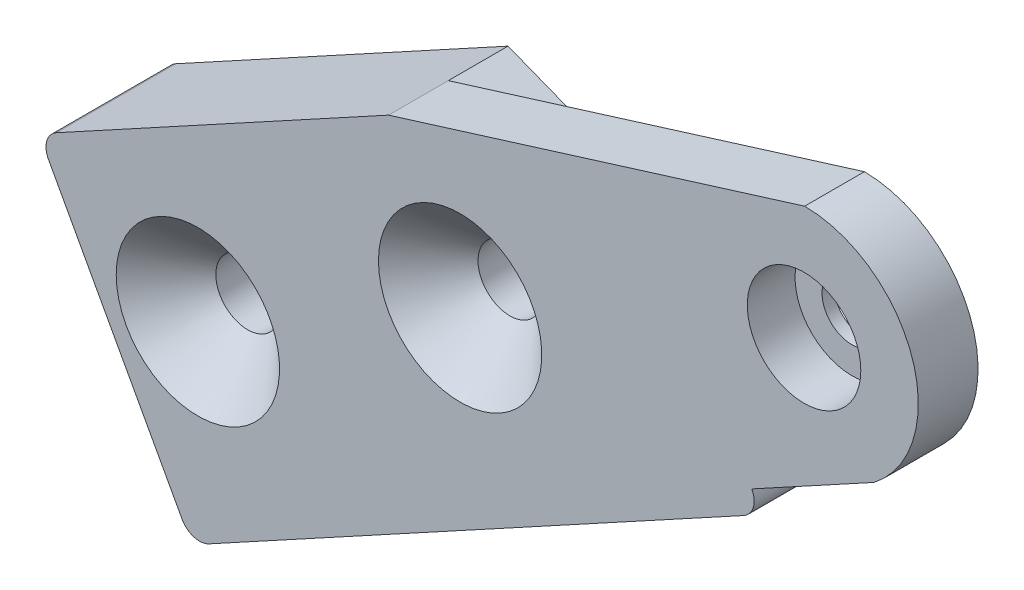
from build123d import *

# Parameters (mm, degrees)
SKETCH4_R           = 1.6
BOSS_EXTRUDE1_DEPTH = 3
BOSS_EXTRUDE2_DEPTH = 1.4
SKETCH6_R           = 1.6
BOSS_EXTRUDE3_DEPTH = 3
SKETCH7_R           = 2.85
CUT_EXTRUDE1_DEPTH  = 2.4
CUT_EXTRUDE2_DEPTH  = 4.6
SKETCH10_R          = 1.5
CUT_EXTRUDE3_DEPTH  = 10
CHAMFER1_SIZE       = 2.5
FILLET1_R           = 1


with BuildPart() as part:
    # Sketch4 → Boss-Extrude1 (new body)
    with BuildSketch(Plane.XY):
        Polygon((263.556481558, 184.695050819), (264.03563075, 183.817317345), (235.433373737, 168.203524869), (234.954224546, 169.081258344), (227.766986674, 182.247260462), (245.321656165, 191.830244291), align=None)
        with Locations((235.749272983, 178.06000536)):
            Circle(SKETCH4_R, mode=Mode.SUBTRACT)
        with Locations((248.915275101, 185.247243232)):
            Circle(SKETCH4_R, mode=Mode.SUBTRACT)
    extrude(amount=BOSS_EXTRUDE1_DEPTH)

    # Sketch5 → Boss-Extrude2 (add)
    with BuildSketch(Plane(origin=(0, 0, 0), x_dir=(-1, 0, 0), z_dir=(0, 0, -1))):
        Polygon((-263.556481558, 184.695050819), (-264.03563075, 183.817317345), (-235.433373737, 168.203524869), (-234.954224546, 169.081258344), align=None)
    extrude(amount=BOSS_EXTRUDE2_DEPTH)

    # Sketch6 → Boss-Extrude3 (add)
    with BuildSketch(Plane.XY.offset(3)):
        with BuildLine():
            Line((227.766986674, 182.247260462), (257.291019991, 198.364244833))
            Line((257.291019991, 198.364244833), (266.21359493, 198.317204861))
            ThreePointArc((266.21359493, 198.317204861), (271.61517707, 194.425420779), (269.70061588, 188.049095159))
            Line((269.70061588, 188.049095159), (263.556481558, 184.695050819))
            Line((263.556481558, 184.695050819), (264.03563075, 183.817317345))
            Line((264.03563075, 183.817317345), (235.433373737, 168.203524869))
            Line((235.433373737, 168.203524869), (234.954224546, 169.081258344))
            Line((234.954224546, 169.081258344), (227.766986674, 182.247260462))
        make_face()
        with Locations((248.915275101, 185.247243232)):
            Circle(SKETCH6_R, mode=Mode.SUBTRACT)
        with Locations((235.749272983, 178.06000536)):
            Circle(SKETCH6_R, mode=Mode.SUBTRACT)
    extrude(amount=BOSS_EXTRUDE3_DEPTH)

    # Sketch7 → Cut-Extrude1 (cut)
    with BuildSketch(Plane.XY.offset(6)):
        with Locations((266.183352442, 192.580788532)):
            Circle(SKETCH7_R)
    extrude(amount=-CUT_EXTRUDE1_DEPTH, mode=Mode.SUBTRACT)

    # Sketch9 → Cut-Extrude2 (cut)
    with BuildSketch(Plane(origin=(0, 0, 3), x_dir=(-1, 0, 0), z_dir=(0, 0, -1))):
        Polygon((-245.321656165, 191.830244291), (-266.21359493, 198.317204861), (-257.291019991, 198.364244833), align=None)
    extrude(amount=-CUT_EXTRUDE2_DEPTH, mode=Mode.SUBTRACT)

    # Sketch10 → Cut-Extrude3 (cut)
    with BuildSketch(Plane.XY.offset(3.6)):
        with Locations((266.183352442, 192.580788532)):
            Circle(SKETCH10_R)
    extrude(amount=-CUT_EXTRUDE3_DEPTH, mode=Mode.SUBTRACT)

    # Chamfer1
    chamfer1_edges = [part.edges().sort_by_distance(p)[0] for p in [
        (247.315275101, 185.247243232, 6),
        (234.149272983, 178.06000536, 6),
    ]]
    chamfer(chamfer1_edges, length=CHAMFER1_SIZE)

    # Fillet1
    fillet1_edges = [part.edges().sort_by_distance(p)[0] for p in [
        (264.03563075, 183.817317345, 2.3),
        (227.766986674, 182.247260462, 3),
        (235.433373737, 168.203524869, 2.3),
    ]]
    fillet(fillet1_edges, radius=FILLET1_R - 0.0001)  # a hair under: the kernel refuses the full size


solid = part.part
